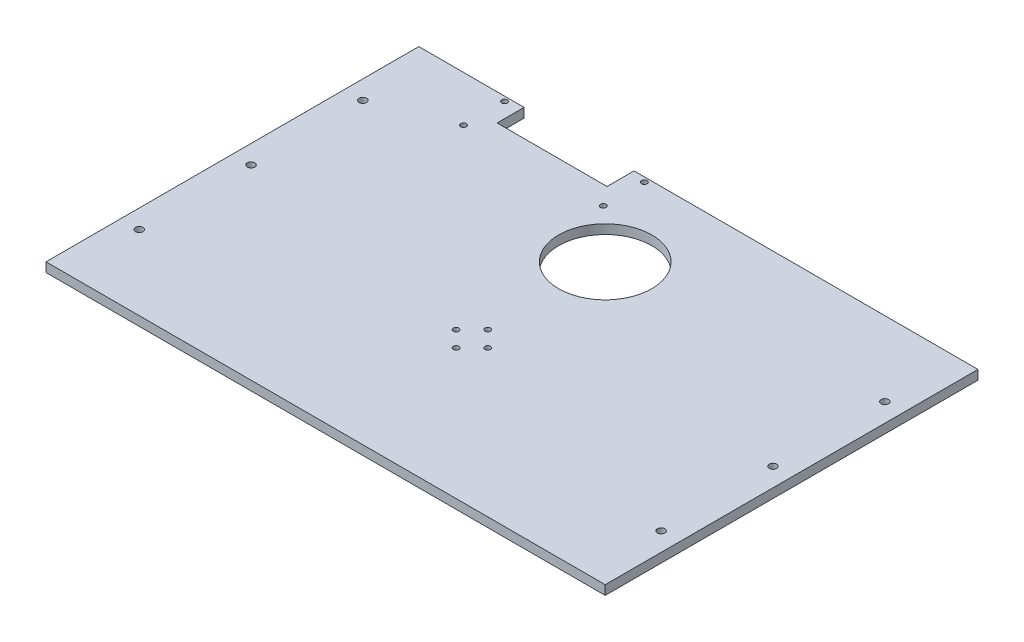
from build123d import *

# Parameters (mm, degrees)
SKETCH1_W           = 300
SKETCH1_H           = 200
BOSS_EXTRUDE1_DEPTH = 5
SKETCH2_R           = 2
SKETCH2_R_2         = 25
CUT_EXTRUDE2_DEPTH  = 181.346887969
SKETCH4_R           = 1.5
CUT_EXTRUDE3_DEPTH  = 181.346887969
SKETCH6_W           = 59
SKETCH6_H           = 14.5
CUT_EXTRUDE4_DEPTH  = 5
SKETCH7_R           = 1.5
CUT_EXTRUDE5_DEPTH  = 181.346887969


with BuildPart() as part:
    # Sketch1 → Boss-Extrude1 (new body)
    with BuildSketch(Plane(origin=(0, 0, 0), x_dir=(1, 0, 0), z_dir=(0, 1, 0))):
        Rectangle(SKETCH1_W, SKETCH1_H)
    extrude(amount=BOSS_EXTRUDE1_DEPTH)

    # Sketch2 → Cut-Extrude2 (cut, through all)
    with BuildSketch(Plane(origin=(0, 5, 0), x_dir=(1, 0, 0), z_dir=(0, 1, 0))):
        with Locations((-140, 0)):
            Circle(SKETCH2_R)
        with Locations((-140, 60)):
            Circle(SKETCH2_R)
        with Locations((-140, -60)):
            Circle(SKETCH2_R)
        with Locations((140, -60)):
            Circle(SKETCH2_R)
        with Locations((140, 60)):
            Circle(SKETCH2_R)
        with Locations((140, 0)):
            Circle(SKETCH2_R)
        with Locations((0, 50)):
            Circle(SKETCH2_R_2)
    extrude(amount=-CUT_EXTRUDE2_DEPTH, mode=Mode.SUBTRACT)

    # Sketch4 → Cut-Extrude3 (cut, through all)
    with BuildSketch(Plane(origin=(0, 5, 0), x_dir=(1, 0, 0), z_dir=(0, 1, 0))):
        with Locations((-101.5, 97.5)):
            Circle(SKETCH4_R)
        with Locations((-26.5, 97.5)):
            Circle(SKETCH4_R)
        with Locations((-26.5, 75.5)):
            Circle(SKETCH4_R)
        with Locations((-101.5, 75.5)):
            Circle(SKETCH4_R)
    extrude(amount=-CUT_EXTRUDE3_DEPTH, mode=Mode.SUBTRACT)

    # Sketch6 → Cut-Extrude4 (cut)
    with BuildSketch(Plane.XZ):
        with Locations((-64, -92.75)):
            Rectangle(SKETCH6_W, SKETCH6_H)
    extrude(amount=-CUT_EXTRUDE4_DEPTH, mode=Mode.SUBTRACT)

    # Sketch7 → Cut-Extrude5 (cut, through all)
    with BuildSketch(Plane(origin=(0, 5, 0), x_dir=(1, 0, 0), z_dir=(0, 1, 0))):
        with Locations((0, -13)):
            Circle(SKETCH7_R)
        with Locations((0, -30)):
            Circle(SKETCH7_R)
        with Locations((-8.5, -21.5)):
            Circle(SKETCH7_R)
        with Locations((8.5, -21.5)):
            Circle(SKETCH7_R)
    extrude(amount=-CUT_EXTRUDE5_DEPTH, mode=Mode.SUBTRACT)


solid = part.part
